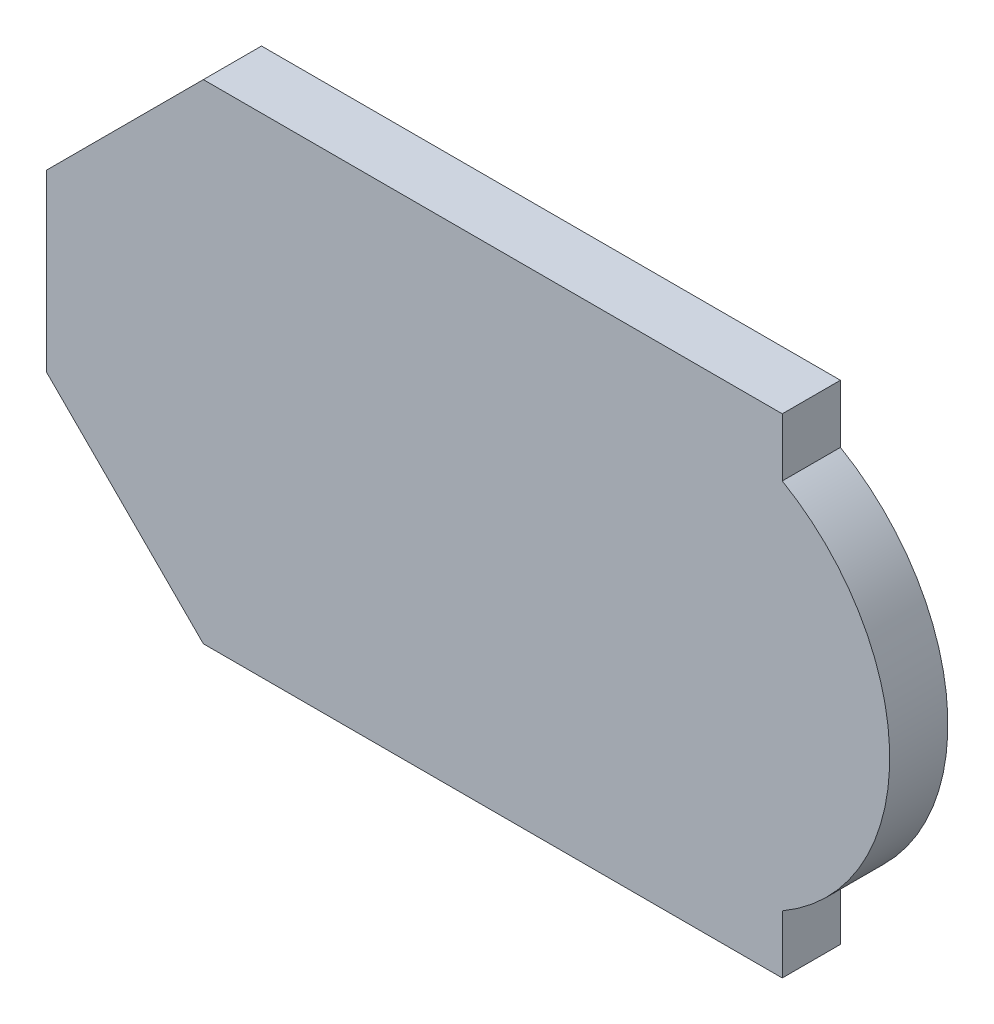
from build123d import *

# Parameters (mm, degrees)
SM_BASE_FLANGE_1_DEPTH = 5


# Sheet-metal steps are written as plain solids
with BuildPart() as part:
    # Sketch 1 → Базовая кромка1 (new body)
    with BuildSketch(Plane.XY):
        with BuildLine():
            Line((29.76239566, 16.000000043), (29.76239566, 21.000000043))
            Line((29.76239566, 21.000000043), (-20, 21.000000043))
            Line((-20, 21.000000043), (-33.500000043, 7.5))
            Line((-33.500000043, 7.5), (-33.500000043, -7.5))
            Line((-33.500000043, -7.5), (-20, -21.000000043))
            Line((-20, -21.000000043), (29.76239566, -21.000000043))
            Line((29.76239566, -21.000000043), (29.76239566, -16.000000043))
            ThreePointArc((29.76239566, -16.000000043), (39.00000001, -1.1e-08), (29.76239566, 16.000000043))
        make_face()
    extrude(amount=-SM_BASE_FLANGE_1_DEPTH)


solid = part.part
